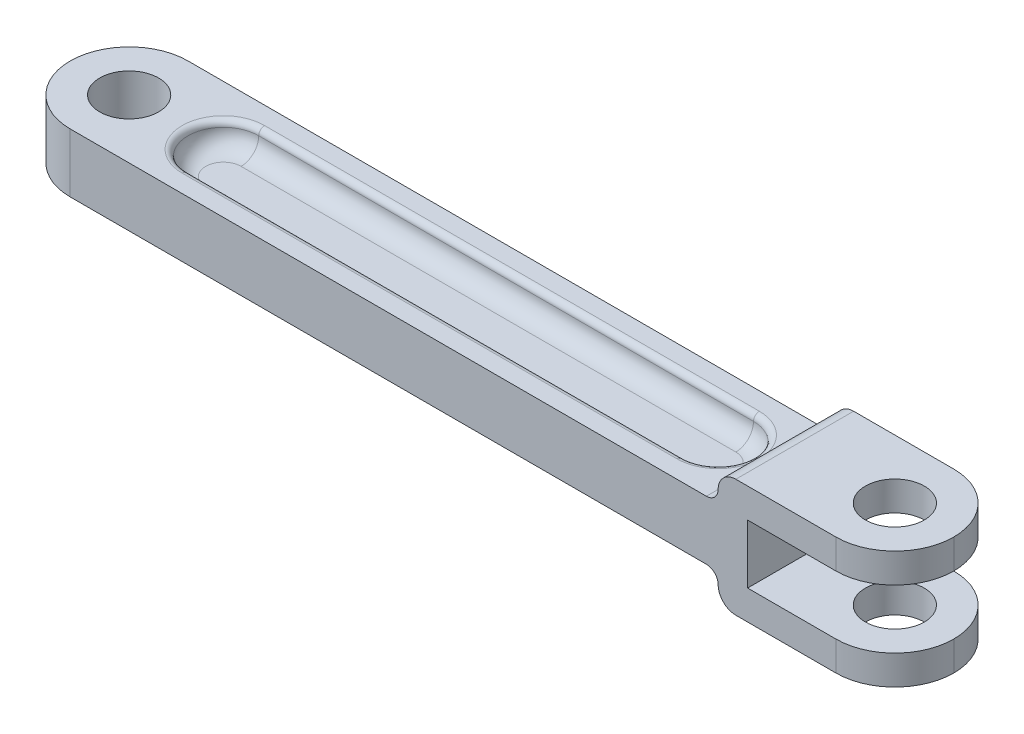
from build123d import *

# Parameters (mm, degrees)
BOSS_EXTRUDE1_DEPTH = 5
FILLET8_R           = 2.5
SKETCH5_R           = 1.25
CUT_EXTRUDE4_DEPTH  = 24.289688565
SKETCH6_R           = 1.25
CUT_EXTRUDE5_DEPTH  = 24.523330833
FILLET9_R           = 0.75
FILLET10_R          = 0.5
SKETCH7_R           = 1.25
CUT_EXTRUDE6_DEPTH  = 1
FILLET11_R          = 0.75
FILLET12_R          = 0.25


with BuildPart() as part:
    # Sketch1 → Boss-Extrude1 (new body)
    with BuildSketch(Plane.XY):
        Polygon((-15.064601776, 1.25), (-15.064601776, -1.25), (14.935398224, -1.25), (14.935398224, -2.5), (22.435398224, -2.5), (22.435398224, -1.25), (16.185398224, -1.25), (16.185398224, 0), (16.185398224, 1.25), (22.435398224, 1.25), (22.435398224, 2.5), (14.935398224, 2.5), (14.935398224, 1.25), align=None)
    extrude(amount=BOSS_EXTRUDE1_DEPTH)

    # Fillet8
    fillet8_edges = [part.edges().sort_by_distance(p)[0] for p in [
        (22.435398224, -1.875, 5),
        (22.435398224, -1.875, 0),
        (22.435398224, 1.875, 0),
        (22.435398224, 1.875, 5),
        (-15.064601776, 0, 0),
        (-15.064601776, 0, 5),
    ]]
    fillet(fillet8_edges, radius=FILLET8_R - 0.0001)  # a hair under: the kernel refuses the full size

    # Sketch5 → Cut-Extrude4 (cut, through all)
    with BuildSketch(Plane(origin=(0, 1.25, 0), x_dir=(1, 0, 0), z_dir=(0, 1, 0))):
        with Locations(Location((-12.564601776, -2.5, 0), (0, 0, 270))):
            Circle(SKETCH5_R)
    extrude(amount=-CUT_EXTRUDE4_DEPTH, mode=Mode.SUBTRACT)

    # Sketch6 → Cut-Extrude5 (cut, through all)
    with BuildSketch(Plane(origin=(0, 2.5, 0), x_dir=(1, 0, 0), z_dir=(0, 1, 0))):
        with Locations(Location((19.935398224, -2.5, 0), (0, 0, 270))):
            Circle(SKETCH6_R)
    extrude(amount=-CUT_EXTRUDE5_DEPTH, mode=Mode.SUBTRACT)

    # Fillet9
    fillet9_edges = [part.edges().sort_by_distance(p)[0] for p in [
        (14.935398224, 2.5, 2.5),
        (14.935398224, -2.5, 2.5),
    ]]
    fillet(fillet9_edges, radius=FILLET9_R)

    # Fillet10
    fillet10_edges = [part.edges().sort_by_distance(p)[0] for p in [
        (14.935398224, -1.25, 2.5),
        (14.935398224, 1.25, 2.5),
    ]]
    fillet(fillet10_edges, radius=FILLET10_R - 0.0001)  # a hair under: the kernel refuses the full size

    # Sketch7 → Cut-Extrude6 (cut)
    with BuildSketch(Plane(origin=(0, 1.25, 0), x_dir=(1, 0, 0), z_dir=(0, 1, 0))):
        with Locations(Location((-12.564601776, -2.5, 0), (0, 0, 270))):
            Circle(SKETCH7_R)
        with BuildLine():
            Line((-8.564601776, -1), (12.435398224, -1))
            ThreePointArc((12.435398224, -1), (13.935398224, -2.5), (12.435398224, -4))
            Line((12.435398224, -4), (-8.564601776, -4))
            ThreePointArc((-8.564601776, -4), (-10.064601776, -2.5), (-8.564601776, -1))
        make_face()
    cut_extrude6 = extrude(amount=-CUT_EXTRUDE6_DEPTH, mode=Mode.SUBTRACT)

    # Mirror2: Cut-Extrude6 across plane
    add(cut_extrude6.mirror(Plane.ZX), mode=Mode.SUBTRACT)

    # Fillet11
    fillet11_edges = [part.edges().sort_by_distance(p)[0] for p in [
        (-10.064601776, 0.25, 2.5),
        (1.935398224, 0.25, 1),
        (13.935398224, 0.25, 2.5),
        (1.935398224, 0.25, 4),
        (-10.064601776, -0.25, 2.5),
        (1.935398224, -0.25, 4),
        (13.935398224, -0.25, 2.5),
        (1.935398224, -0.25, 1),
    ]]
    fillet(fillet11_edges, radius=FILLET11_R)

    # Fillet12
    fillet12_edges = [part.edges().sort_by_distance(p)[0] for p in [
        (1.935398224, -1.25, 1),
        (13.935398224, -1.25, 2.5),
        (1.935398224, -1.25, 4),
        (1.935398224, 1.25, 1),
        (13.935398224, 1.25, 2.5),
        (1.935398224, 1.25, 4),
        (-10.064601776, -1.25, 2.5),
        (-10.064601776, 1.25, 2.5),
    ]]
    fillet(fillet12_edges, radius=FILLET12_R - 0.0001)  # a hair under: the kernel refuses the full size


solid = part.part
